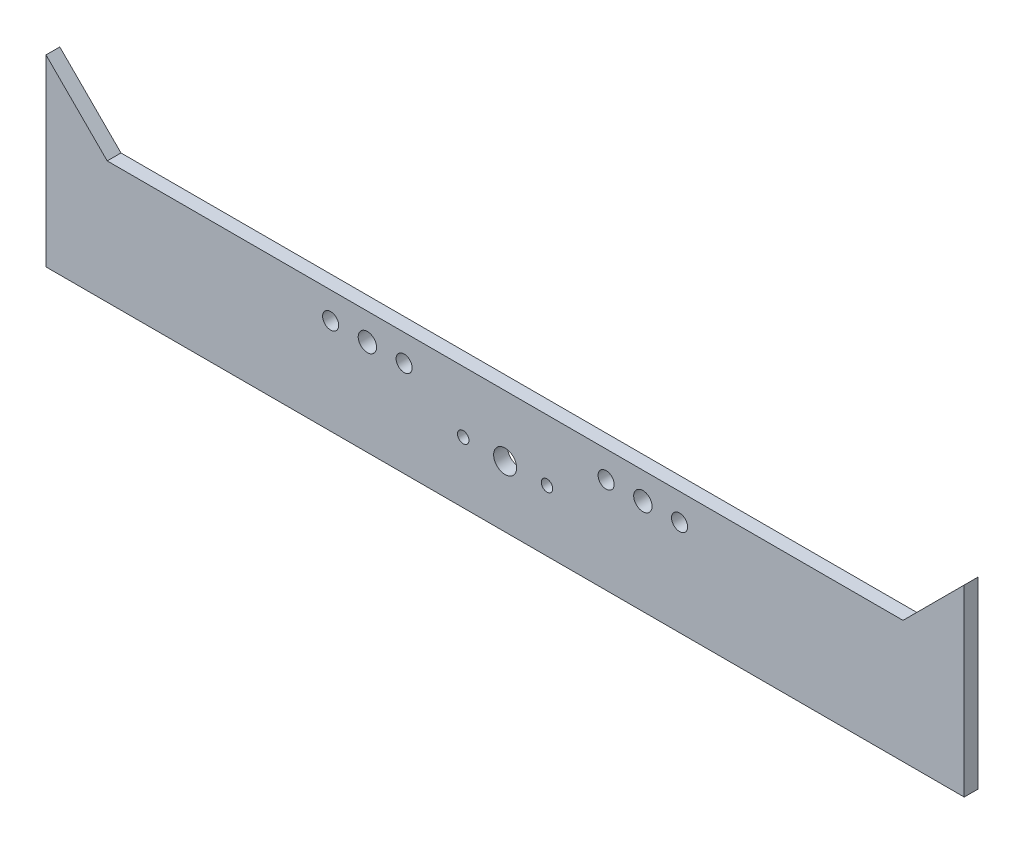
from build123d import *

# Parameters (mm, degrees)
BOSS_EXTRUDE1_DEPTH = 6
SKETCH2_R           = 5
SKETCH2_R_2         = 4
SKETCH2_R_3         = 3.5
SKETCH2_R_4         = 2.5
CUT_EXTRUDE1_DEPTH  = 216.490138986


with BuildPart() as part:
    # Sketch1 → Boss-Extrude1 (new body)
    with BuildSketch(Plane.XY):
        Polygon((-200, 0), (200, 0), (200, 80), (173.333333333, 53.333333333), (-173.333333333, 53.333333333), (-200, 80), align=None)
    extrude(amount=BOSS_EXTRUDE1_DEPTH)

    # Sketch2 → Cut-Extrude1 (cut, through all)
    with BuildSketch(Plane.XY.offset(6)):
        with Locations((0, 26.665)):
            Circle(SKETCH2_R)
        with Locations((60, 41.665)):
            Circle(SKETCH2_R_2)
        with Locations((76, 41.665)):
            Circle(SKETCH2_R_3)
        with Locations((44, 41.665)):
            Circle(SKETCH2_R_3)
        with Locations((-44, 41.665)):
            Circle(SKETCH2_R_3)
        with Locations((-76, 41.665)):
            Circle(SKETCH2_R_3)
        with Locations((-60, 41.665)):
            Circle(SKETCH2_R_2)
        with Locations((18.25, 26.665)):
            Circle(SKETCH2_R_4)
        with Locations((-18.25, 26.665)):
            Circle(SKETCH2_R_4)
    extrude(amount=-CUT_EXTRUDE1_DEPTH, mode=Mode.SUBTRACT)


solid = part.part
